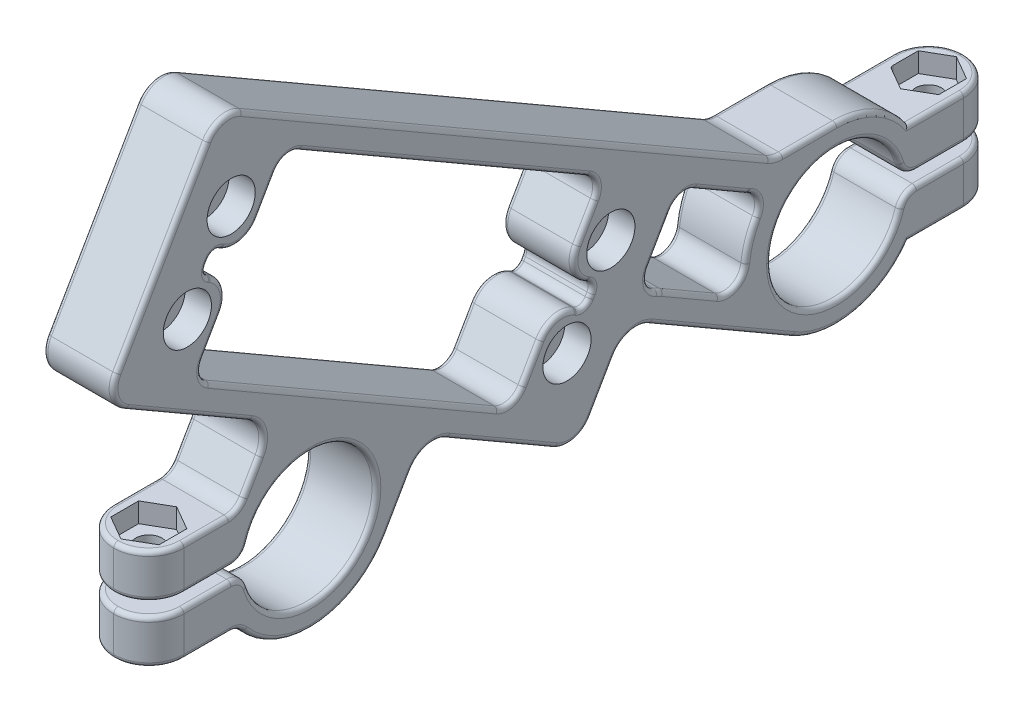
from build123d import *

# Parameters (mm, degrees)
SKETCH1_R             = 7.5
SKETCH1_R_2           = 1.5
BOSS_EXTRUDE1_DEPTH   = 8
FILLET1_R             = 3
FILLET2_R             = 10
FILLET3_R             = 3
CUT_EXTRUDE2_DEPTH    = 10
CUT_EXTRUDE1_DEPTH    = 10
FILLET7_R             = 2
FILLET8_R             = 2
FILLET9_R             = 3
FILLET10_R            = 1
SKETCH4_W             = 9.883962472
SKETCH4_H             = 1.5
CUT_EXTRUDE3_DEPTH    = 10
BOSS_EXTRUDE5_START   = 0.75
SKETCH6_W             = 8
SKETCH6_H             = 11
SKETCH6_R             = 1.5
BOSS_EXTRUDE5_DEPTH   = 5
BOSS_EXTRUDE6_START   = -5.75
SKETCH6_2_W           = 8
SKETCH6_2_H           = 11
SKETCH6_2_R           = 1.5
BOSS_EXTRUDE6_DEPTH   = 5
CUT_EXTRUDE4_START    = -3.5
CUT_EXTRUDE4_DEPTH    = 5
FILLET11_R            = 4
FILLET12_R            = 2
FILLET13_R            = 2
CUT_EXTRUDE5_DEPTH    = 2.5
SKETCH9_R             = 2.75
CUT_EXTRUDE6_DEPTH    = 3
SKETCH10_R            = 2.75
CUT_EXTRUDE7_DEPTH    = 3
FILLET11_OF_MIRROR1_R = 4
FILLET15_R            = 2
FILLET16_R            = 0.5


# Some blends are built 0.0001 mm under size
with BuildPart() as part:
    # Sketch1 → Boss-Extrude1 (new body)
    with BuildSketch(Plane(origin=(0, 0, 0), x_dir=(0, 0, -1), z_dir=(1, 0, 0))):
        Polygon((-40.331392095, 46.585122217), (23.035898385, 10), (40, 10), (40, -10), (27.320508076, -10), (6.155121906, 2.219841403), (0.494223521, -7.585122217), (-17.000644347, 2.515544457), (-24.226497308, -10), (-40, -10), (-40, 2.679491924), (-34.321152423, 12.515544457), (-39.444863729, 15.473720558), (-53.581392095, 23.635449016), align=None)
        with Locations((-30, 0)):
            Circle(SKETCH1_R, mode=Mode.SUBTRACT)
        with Locations((30, 0)):
            Circle(SKETCH1_R, mode=Mode.SUBTRACT)
        with Locations((-39.069219382, 36.330127019)):
            Circle(SKETCH1_R_2, mode=Mode.SUBTRACT)
        with Locations(Location((4.232050808, 11.330127019, 0), (0, 0, 180))):
            Circle(SKETCH1_R_2, mode=Mode.SUBTRACT)
        with Locations((-0.767949192, 2.669872981)):
            Circle(SKETCH1_R_2, mode=Mode.SUBTRACT)
        with Locations(Location((-44.069219382, 27.669872981, 0), (0, 0, 180))):
            Circle(SKETCH1_R_2, mode=Mode.SUBTRACT)
        Polygon((-43.230117767, 21.123239611), (-6.857050808, 0.123239611), (3.392949192, 17.876760389), (-32.980117767, 38.876760389), align=None, mode=Mode.SUBTRACT)
    extrude(amount=BOSS_EXTRUDE1_DEPTH)

    # Fillet1
    fillet1_edges = [part.edges().sort_by_distance(p)[0] for p in [
        (4, -7.585122217, -0.494223521),
        (4, 23.635449016, 53.581392095),
        (4, 46.585122217, 40.331392095),
    ]]
    fillet(fillet1_edges, radius=FILLET1_R)

    # Fillet2
    fillet2_edges = [part.edges().sort_by_distance(p)[0] for p in [
        (4, -10, 40),
        (4, -10, 24.226497308),
        (4, 10, -40),
        (4, -10, -40),
        (4, -10, -27.320508076),
        (4, 2.679491924, 40),
    ]]
    fillet(fillet2_edges, radius=FILLET2_R - 0.0001)  # a hair under: the kernel refuses the full size

    # Fillet3
    fillet3_edges = [part.edges().sort_by_distance(p)[0] for p in [
        (4, 2.219841403, -6.155121906),
        (4, 2.515544457, 17.000644347),
        (4, 12.515544457, 34.321152423),
        (4, 10, -23.035898385),
    ]]
    fillet(fillet3_edges, radius=FILLET3_R)

    # Sketch3 → Cut-Extrude2 (cut)
    with BuildSketch(Plane(origin=(8, 0, 0), x_dir=(0, 0, -1), z_dir=(1, 0, 0))):
        Polygon((-41.142424462, 33.139230485), (2.505255888, 7.939230485), (1.305255888, 5.860769515), (-42.342424462, 31.060769515), align=None)
    extrude(amount=-CUT_EXTRUDE2_DEPTH, mode=Mode.SUBTRACT)

    # Sketch2 → Cut-Extrude1 (cut, symmetric)
    with BuildSketch(Plane(origin=(8, 0, 0), x_dir=(0, 0, -1), z_dir=(1, 0, 0))):
        with BuildLine():
            Line((7.253198117, 4.121765191), (12.099885954, 12.516474772))
            Line((12.099885954, 12.516474772), (19.798294078, 8.07179677))
            Line((19.798294078, 8.07179677), (22.173762079, 7))
            ThreePointArc((22.173762079, 7), (19.857778824, 2.717599974), (19.722279144, -2.149058866))
            Line((19.722279144, -2.149058866), (10.253198117, 3.317917614))
            ThreePointArc((10.253198117, 3.317917614), (8.806112388, 3.917320149), (7.253198117, 4.121765191))
        make_face()
    extrude(amount=CUT_EXTRUDE1_DEPTH, both=True, mode=Mode.SUBTRACT)

    # Fillet7
    # the kernel refuses this fillet: 2 mm, written as the material it adds along each edge
    with BuildSketch(Plane(origin=(0, 7, -22.173762079), x_dir=(0, 0.4112695013895605, 0.9115137943151393), z_dir=(1, 0, 0))) as fillet7_piece_1:
        with BuildLine():
            CenterArc((2.433271719, 2), FILLET7_R, 174.666527035, 95.333472965)
            ThreePointArc((0.441930591, 2.185904575), (0.279163802, 1.081186129), (0, 0))
            Line((0, 0), (2.433271719, 0))
        make_face()
    extrude(amount=8)
    with BuildSketch(Plane(origin=(0, -2.149058866, -19.722279144), x_dir=(0, 0.9988946000851978, 0.04700614768977012), z_dir=(1, 0, 0))) as fillet7_piece_2:
        with BuildLine():
            CenterArc((3.644004413, 1.974738827), FILLET7_R, 147.305753313, 113.578178478)
            Line((1.960874362, 3.055050463), (0, 0))
            ThreePointArc((0, 0), (1.663567232, 0.132621157), (3.327134464, 0))
        make_face()
    extrude(amount=8)
    with BuildSketch(Plane(origin=(8, 4.121765191, -7.253198117), x_dir=(0, -0.19782196186948442, -0.980237966721402), z_dir=(-1, 0, 0))) as fillet7_piece_3:
        with BuildLine():
            CenterArc((2.769507466, -1.960475933), FILLET7_R, 101.409622109, 97.180755781)
            Line((0.873863542, -2.598076211), (0, 0))
            ThreePointArc((0, 0), (1.186931771, -0.1185722), (2.373863542, 0))
        make_face()
    extrude(amount=8)
    with BuildSketch(Plane(origin=(8, 12.516474772, -12.099885954), x_dir=(0, -0.8660254037844385, 0.5000000000000004), z_dir=(-1, 0, 0))) as fillet7_piece_4:
        with BuildLine():
            CenterArc((FILLET7_R, -FILLET7_R), FILLET7_R, 90, 90)
            Line((0, -FILLET7_R), (0, 0))
            Line((0, 0), (FILLET7_R, 0))
        make_face()
    extrude(amount=8)
    # the kernel refuses this fillet: 2 mm, written as the material it takes off along each edge
    with BuildSketch(Plane(origin=(-0.249588022, 8.07179677, -19.798294078), x_dir=(0, 0.4999999999999966, 0.8660254037844406), z_dir=(1, 0, 0))) as fillet7_2_piece_1:
        with BuildLine():
            CenterArc((FILLET7_R * 0.0499176044642, -FILLET7_R), FILLET7_R, 90, 5.715392126)
            Line((-FILLET7_R * 0.0496694566882, -FILLET7_R * 0.00497114752836), (0, 0))
            Line((0, 0), (FILLET7_R * 0.0499176044643, 0))
        make_face()
    extrude(amount=8.499176045, mode=Mode.SUBTRACT)

    # Fillet8
    fillet8_edges = [part.edges().sort_by_distance(p)[0] for p in [
        (4, 38.876760389, 32.980117767),
        (4, 21.123239611, 43.230117767),
        (4, 0.123239611, 6.857050808),
        (4, 17.876760389, -3.392949192),
    ]]
    fillet(fillet8_edges, radius=FILLET8_R)

    # Fillet9
    fillet9_edges = [part.edges().sort_by_distance(p)[0] for p in [
        (4, 7.960769515, 2.332050808),
        (4, 10.039230485, 1.132050808),
        (4, 31.039230485, 37.505117767),
        (4, 28.960769515, 38.705117767),
    ]]
    fillet(fillet9_edges, radius=FILLET9_R)

    # Fillet10
    fillet10_edges = [part.edges().sort_by_distance(p)[0] for p in [
        (4, 33.139230485, 41.142424462),
        (4, 31.060769515, 42.342424462),
        (4, 7.939230485, -2.505255888),
        (4, 5.860769515, -1.305255888),
    ]]
    fillet(fillet10_edges, radius=FILLET10_R)

    # Sketch4 → Cut-Extrude3 (cut)
    with BuildSketch(Plane(origin=(8, 0, 0), x_dir=(0, 0, -1), z_dir=(1, 0, 0))):
        with Locations((-38.575287745, 0)):
            Rectangle(SKETCH4_W, SKETCH4_H)
    cut_extrude3 = extrude(amount=-CUT_EXTRUDE3_DEPTH, mode=Mode.SUBTRACT)

    # Sketch6 → Boss-Extrude5 (add)
    with BuildSketch(Plane(origin=(0, 0, 0), x_dir=(-1, 0, 0), z_dir=(0, -1, 0)).offset(BOSS_EXTRUDE5_START)):
        with Locations((-4, -42.962405778)):
            Rectangle(SKETCH6_W, SKETCH6_H)
        with Locations(Location((-4, -44.462405778, 0), (0, 0, 90))):
            Circle(SKETCH6_R, mode=Mode.SUBTRACT)
    boss_extrude5 = extrude(amount=BOSS_EXTRUDE5_DEPTH)

    # Sketch6<2> → Boss-Extrude6 (add)
    with BuildSketch(Plane(origin=(0, 0, 0), x_dir=(-1, 0, 0), z_dir=(0, -1, 0)).offset(BOSS_EXTRUDE6_START)):
        with Locations((-4, -42.962405778)):
            Rectangle(SKETCH6_2_W, SKETCH6_2_H)
        with Locations(Location((-4, -44.462405778, 0), (0, 0, 90))):
            Circle(SKETCH6_2_R, mode=Mode.SUBTRACT)
    boss_extrude6 = extrude(amount=BOSS_EXTRUDE6_DEPTH)

    # Sketch7 → Cut-Extrude4 (cut)
    with BuildSketch(Plane(origin=(0, 0, 0), x_dir=(-1, 0, 0), z_dir=(0, -1, 0)).offset(CUT_EXTRUDE4_START)):
        Polygon((-4, -41.286979298), (-6.75, -42.874692538), (-6.75, -46.050119019), (-4, -47.637832259), (-1.25, -46.050119019), (-1.25, -42.874692538), align=None)
    cut_extrude4 = extrude(amount=-CUT_EXTRUDE4_DEPTH, mode=Mode.SUBTRACT)

    # Fillet11
    fillet11_edges = [part.edges().sort_by_distance(p)[0] for p in [
        (8, -3.25, 48.462405778),
        (0, -3.25, 48.462405778),
        (0, 3.25, 48.462405778),
        (8, 3.25, 48.462405778),
    ]]
    fillet(fillet11_edges, radius=FILLET11_R - 0.0001)  # a hair under: the kernel refuses the full size

    # Fillet12
    fillet12_edges = [part.edges().sort_by_distance(p)[0] for p in [
        (4, -5.75, 38.18158214),
        (4, 5.75, 38.227241336),
    ]]
    fillet(fillet12_edges, radius=FILLET12_R)

    # Fillet13
    fillet13_edges = [part.edges().sort_by_distance(p)[0] for p in [
        (4, -0.75, 37.462405778),
        (4, 0.75, 37.462405778),
    ]]
    fillet(fillet13_edges, radius=FILLET13_R)

    # Sketch8 → Cut-Extrude5 (cut)
    with BuildSketch(Plane.ZY):
        Polygon((-0.767949192, 11.330127019), (-2.5, 14.330127019), (-5.964101615, 14.330127019), (-7.696152423, 11.330127019), (-5.964101615, 8.330127019), (-2.5, 8.330127019), align=None)
        Polygon((37.337168574, 33.330127019), (35.605117767, 36.330127019), (37.337168574, 39.330127019), (40.801270189, 39.330127019), (42.533320997, 36.330127019), (40.801270189, 33.330127019), align=None)
        Polygon((2.5, 5.669872981), (4.232050808, 2.669872981), (2.5, -0.330127019), (-0.964101615, -0.330127019), (-2.696152423, 2.669872981), (-0.964101615, 5.669872981), align=None)
        Polygon((42.337168574, 30.669872981), (40.605117767, 27.669872981), (42.337168574, 24.669872981), (45.801270189, 24.669872981), (47.533320997, 27.669872981), (45.801270189, 30.669872981), align=None)
    extrude(amount=-CUT_EXTRUDE5_DEPTH, mode=Mode.SUBTRACT)

    # Sketch9 → Cut-Extrude6 (cut)
    with BuildSketch(Plane(origin=(8, 0, 0), x_dir=(0, 0, -1), z_dir=(1, 0, 0))):
        with Locations((-0.767949192, 2.669872981)):
            Circle(SKETCH9_R)
        with Locations((4.232050808, 11.330127019)):
            Circle(SKETCH9_R)
        with Locations((-44.069219382, 27.669872981)):
            Circle(SKETCH9_R)
        with Locations((-39.069219382, 36.330127019)):
            Circle(SKETCH9_R)
    extrude(amount=-CUT_EXTRUDE6_DEPTH, mode=Mode.SUBTRACT)

    # Sketch10 → Cut-Extrude7 (cut)
    with BuildSketch(Plane.XZ.offset(5.75)):
        with Locations(Location((4, 44.462405778, 0), (0, 0, 270))):
            Circle(SKETCH10_R)
    cut_extrude7 = extrude(amount=-CUT_EXTRUDE7_DEPTH, mode=Mode.SUBTRACT)

    # Mirror1: Cut-Extrude3, Boss-Extrude5, Boss-Extrude6, Cut-Extrude4, Cut-Extrude7 across plane
    add(cut_extrude3.mirror(Plane.XY), mode=Mode.SUBTRACT)
    add(boss_extrude5.mirror(Plane.XY))
    add(boss_extrude6.mirror(Plane.XY))
    add(cut_extrude4.mirror(Plane.XY), mode=Mode.SUBTRACT)
    add(cut_extrude7.mirror(Plane.XY), mode=Mode.SUBTRACT)

    # Fillet11 of Mirror1
    fillet11_of_mirror1_edges = [part.edges().sort_by_distance(p)[0] for p in [
        (8, -3.25, -48.462405778),
        (0, -3.25, -48.462405778),
        (0, 3.25, -48.462405778),
        (8, 3.25, -48.462405778),
    ]]
    fillet(fillet11_of_mirror1_edges, radius=FILLET11_OF_MIRROR1_R - 0.0001)  # a hair under: the kernel refuses the full size

    # Fillet15
    fillet15_edges = [part.edges().sort_by_distance(p)[0] for p in [
        (4, 0.75, -37.462405778),
        (4, -0.75, -37.462405778),
    ]]
    fillet(fillet15_edges, radius=FILLET15_R)

    # Fillet16
    fillet16_edges = [part.edges().sort_by_distance(p)[0] for p in [
        (0, -8.660267435, 24.999992265),
        (0, -9.071476592, 34.20820251),
        (8, 10, -26.919922981),
        (8, -2.541290877, 19.920209588),
        (8, -8.660267435, 24.999992265),
        (0, 8.333734123, 36.735521745),
        (8, 8.333734123, 36.735521745),
        (0, -2.53478888, 8.253210413),
        (8, -2.53478888, 8.253210413),
        (0, 27.743523003, 7.696784961),
        (8, 27.743523003, 7.696784961),
        (0, -3.970213016, -16.876610661),
        (8, -3.970213016, -16.876610661),
        (0, 12.193925381, 35.521451155),
        (8, 12.193925381, 35.521451155),
        (0, 1.315245724, 16.679025271),
        (8, 1.315245724, 16.679025271),
        (0, 10.102222521, -23.063288827),
        (8, 10.102222521, -23.063288827),
        (0, 1.01954267, -6.476740982),
        (8, 1.01954267, -6.476740982),
        (0, 3.495587651, -9.921911696),
        (8, 3.495587651, -9.921911696),
        (0, 3.24815554, -20.015037026),
        (8, 3.24815554, -20.015037026),
        (0, 1.491979703, -13.41581535),
        (8, 1.491979703, -13.41581535),
        (0, 8.640026349, -9.861817413),
        (8, 8.640026349, -9.861817413),
        (0, 9.819094573, -16.771885506),
        (8, 9.819094573, -16.771885506),
        (8, 8.01573402, -19.922548295),
        (8, 8.074012755, -19.79943012),
        (0, 8.01573402, -19.922548295),
        (0, 8.074012755, -19.79943012),
        (8, -0.387250725, -18.479847701),
        (0, -0.387250725, -18.479847701),
        (8, 4.858028456, -8.460155756),
        (0, 4.858028456, -8.460155756),
        (8, 11.716275617, -12.314298671),
        (0, 11.716275617, -12.314298671),
        (8, 6.7973519, -21.03484985),
        (0, 6.7973519, -21.03484985),
        (0, 28.376760389, 14.793584287),
        (8, 28.376760389, 14.793584287),
        (0, 10.623239611, 25.043584287),
        (8, 10.623239611, 25.043584287),
        (0, 3.608991861, 4.844550808),
        (8, 3.608991861, 4.844550808),
        (0, 35.391008139, 34.992617767),
        (8, 35.391008139, 34.992617767),
        (0, 17.662347671, -2.592750037),
        (8, 17.662347671, -2.592750037),
        (0, 0.923438766, 7.071463525),
        (8, 0.923438766, 7.071463525),
        (0, 21.337652329, 42.429918612),
        (8, 21.337652329, 42.429918612),
        (0, 38.076561234, 32.765705049),
        (8, 38.076561234, 32.765705049),
        (0, 8.489230485, -1.552627944),
        (0, 14.391008139, -1.380449192),
        (0, 30.510769515, 41.389796518),
        (0, 24.608991861, 41.217617767),
        (0, 32.239529217, 37.826736843),
        (0, 28.639150439, 39.905416499),
        (0, 6.760470783, 2.010431732),
        (0, 10.360849561, -0.068247925),
        (8, 14.391008139, -1.380449192),
        (8, 6.410769515, -0.352627944),
        (8, 24.608991861, 41.217617767),
        (8, 32.589230485, 40.189796518),
        (8, 32.239529217, 37.826736843),
        (8, 28.639150439, 39.905416499),
        (8, 6.760470783, 2.010431732),
        (8, 10.360849561, -0.068247925),
        (0, 6.9, -1.905255888),
        (8, 6.9, -1.905255888),
        (0, 6.410769515, -0.352627944),
        (8, 8.489230485, -1.552627944),
        (8, 30.510769515, 41.389796518),
        (0, 32.1, 41.742424462),
        (8, 32.1, 41.742424462),
        (0, 32.589230485, 40.189796518),
        (8, 6.260869093, -1.19804953),
        (0, 6.260869093, -1.19804953),
        (8, 7.832024126, -2.105156311),
        (0, 7.832024126, -2.105156311),
        (8, 31.167975874, 41.942324885),
        (0, 31.167975874, 41.942324885),
        (8, 32.739130907, 41.035218104),
        (0, 32.739130907, 41.035218104),
        (8, -0.75, 41.777886259),
        (1.171543586, -0.75, 47.290862192),
        (6.828456414, -0.75, 47.290862192),
        (0, -5.75, 41.812150245),
        (1.171543586, -5.75, 47.290862192),
        (6.828456414, -5.75, 47.290862192),
        (0, 0.75, 41.777886259),
        (0, 5.75, 41.922223826),
        (6.828456414, 0.75, 47.290862192),
        (1.171543586, 0.75, 47.290862192),
        (6.828456414, 5.75, 47.290862192),
        (1.171543586, 5.75, 47.290862192),
        (8, 5.75, 41.922223826),
        (8, -5.75, 41.812150245),
        (8, -9.071476592, 34.20820251),
        (0, 6.017949192, 38.381941874),
        (8, 6.017949192, 38.381941874),
        (8, -5.935706539, 38.320165794),
        (0, -5.935706539, 38.320165794),
        (0, -0.75, 41.777886259),
        (0, 0, 22.5),
        (0, 1.144089863, 37.901187618),
        (0, -1.144089863, 37.901187618),
        (8, 0, 22.5),
        (8, 0.75, 41.777886259),
        (8, 1.144089863, 37.901187618),
        (8, -1.144089863, 37.901187618),
        (8, -5.75, -41.322043959),
        (8, 5.75, -41.322043959),
        (1.25, 4.625, -42.874692538),
        (2.625, 3.5, -42.080835918),
        (8, -0.75, -41.777886259),
        (1.171543586, -0.75, -47.290862192),
        (6.828456414, -0.75, -47.290862192),
        (0, -5.75, -41.322043959),
        (1.171543586, -5.75, -47.290862192),
        (6.828456414, -5.75, -47.290862192),
        (0, 5.75, -41.322043959),
        (0, 0.75, -41.777886259),
        (6.828456414, 0.75, -47.290862192),
        (1.171543586, 0.75, -47.290862192),
        (6.828456414, 5.75, -47.290862192),
        (1.171543586, 5.75, -47.290862192),
        (0, 0, -22.5),
        (8, 0, -22.5),
        (8, 0.75, -41.777886259),
        (8, -1.144089863, -37.901187618),
        (8, 1.144089863, -37.901187618),
        (0, -0.75, -41.777886259),
        (0, -1.144089863, -37.901187618),
        (0, 1.144089863, -37.901187618),
        (0, -2.682640407, -3.324672714),
        (8, -2.682640407, -3.324672714),
        (0, 18.075496736, 43.951272259),
        (0, 35.110285616, 46.956392095),
        (0, 45.384823484, 40.009773019),
        (0, 23.957068092, 52.381093363),
        (0, -6.384823484, -0.172604445),
        (8, 35.110285616, 46.956392095),
        (8, 18.075496736, 43.951272259),
        (8, 45.384823484, 40.009773019),
        (8, 23.957068092, 52.381093363),
        (8, -6.384823484, -0.172604445),
        (0, -2.541290877, 19.920209588),
        (0, 10, -26.919922981),
    ]]
    fillet(fillet16_edges, radius=FILLET16_R)


solid = part.part
